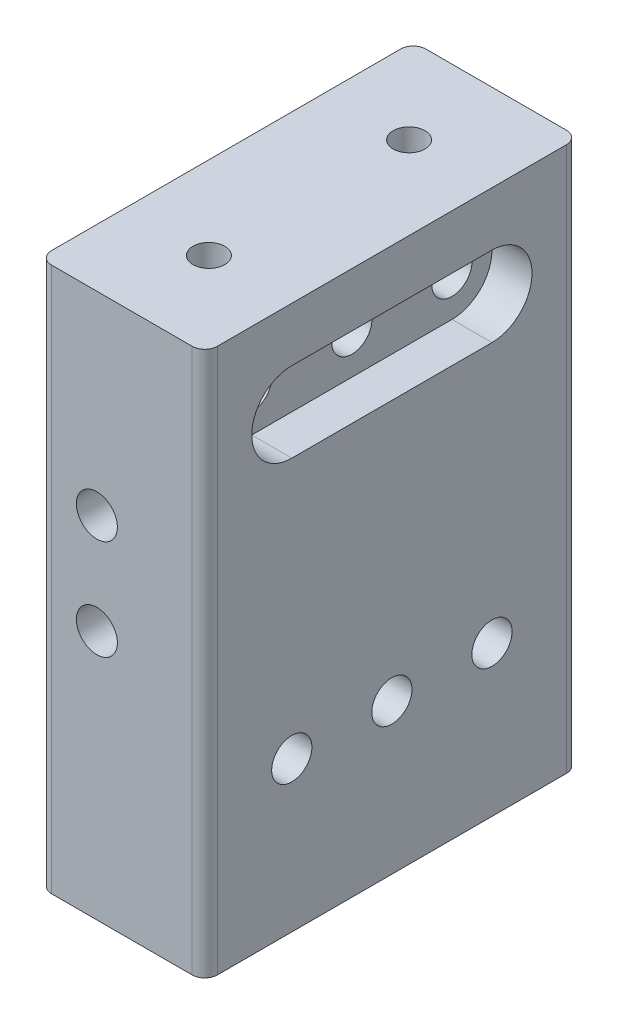
from build123d import *

# Parameters (mm, degrees)
SKETCH1_W           = 21.0312
SKETCH1_H           = 47.4853
BOSS_EXTRUDE1_DEPTH = 31.75
SKETCH2_R           = 2.6035
CUT_EXTRUDE1_DEPTH  = 59.081787674
SKETCH4_R           = 2.5527
CUT_EXTRUDE3_DEPTH  = 45.878584007
FILLET1_R           = 1.5875
CUT_EXTRUDE5_DEPTH  = 5.08
BOSS_EXTRUDE2_DEPTH = 5.588
SKETCH9_R           = 2.0193
CUT_EXTRUDE6_DEPTH  = 5.08
SKETCH10_R          = 2.5527
CUT_EXTRUDE7_DEPTH  = 49.991336443
CUT_EXTRUDE8_DEPTH  = 7.9375


with BuildPart() as part:
    # Sketch1 → Boss-Extrude1 (new, symmetric)
    with BuildSketch(Plane(origin=(0, 0, 0), x_dir=(1, 0, 0), z_dir=(0, 1, 0))):
        Rectangle(SKETCH1_W, SKETCH1_H)
    extrude(amount=BOSS_EXTRUDE1_DEPTH, both=True)

    # Sketch2 → Cut-Extrude1 (cut, through all)
    with BuildSketch(Plane.XY.offset(23.74265)):
        with Locations((-3.175, 0)):
            Circle(SKETCH2_R)
        with Locations((-3.175, 12.7)):
            Circle(SKETCH2_R)
    extrude(amount=-CUT_EXTRUDE1_DEPTH, mode=Mode.SUBTRACT)

    # Sketch4 → Cut-Extrude3 (cut, through all)
    with BuildSketch(Plane(origin=(10.5156, 0, 0), x_dir=(0, 0, -1), z_dir=(1, 0, 0))):
        with Locations((-12.7, 25.4)):
            Circle(SKETCH4_R)
        with Locations((12.7, 25.4)):
            Circle(SKETCH4_R)
        with Locations((0, 25.4)):
            Circle(SKETCH4_R)
    extrude(amount=-CUT_EXTRUDE3_DEPTH, mode=Mode.SUBTRACT)

    # Fillet1
    fillet1_edges = [part.edges().sort_by_distance(p)[0] for p in [
        (10.5156, 0, 23.74265),
        (-10.5156, 0, 23.74265),
        (-10.5156, 0, -23.74265),
        (10.5156, 0, -23.74265),
    ]]
    fillet(fillet1_edges, radius=FILLET1_R)

    # Sketch7 → Cut-Extrude5 (cut)
    with BuildSketch(Plane(origin=(10.5156, 0, 0), x_dir=(0, 0, -1), z_dir=(1, 0, 0))):
        with BuildLine():
            Line((-12.7, 30.48), (12.7, 30.48))
            ThreePointArc((12.7, 30.48), (17.78, 25.4), (12.7, 20.32))
            Line((12.7, 20.32), (-12.7, 20.32))
            ThreePointArc((-12.7, 20.32), (-17.78, 25.4), (-12.7, 30.48))
        make_face()
    extrude(amount=-CUT_EXTRUDE5_DEPTH, mode=Mode.SUBTRACT)

    # Sketch8 → Boss-Extrude2 (add)
    with BuildSketch(Plane(origin=(0, 31.75, 0), x_dir=(1, 0, 0), z_dir=(0, 1, 0))):
        with BuildLine():
            Line((-8.9281, -23.74265), (8.9281, -23.74265))
            ThreePointArc((8.9281, -23.74265), (10.050632015, -23.277682015), (10.5156, -22.15515))
            Line((10.5156, -22.15515), (10.5156, 22.15515))
            ThreePointArc((10.5156, 22.15515), (10.050632015, 23.277682015), (8.9281, 23.74265))
            Line((8.9281, 23.74265), (-8.9281, 23.74265))
            ThreePointArc((-8.9281, 23.74265), (-10.050632015, 23.277682015), (-10.5156, 22.15515))
            Line((-10.5156, 22.15515), (-10.5156, -22.15515))
            ThreePointArc((-10.5156, -22.15515), (-10.050632015, -23.277682015), (-8.9281, -23.74265))
        make_face()
    extrude(amount=BOSS_EXTRUDE2_DEPTH)

    # Sketch9 → Cut-Extrude6 (cut)
    with BuildSketch(Plane(origin=(0, 37.338, 0), x_dir=(1, 0, 0), z_dir=(0, 1, 0))):
        with Locations((0, 12.7)):
            Circle(SKETCH9_R)
        with Locations((0, -12.7)):
            Circle(SKETCH9_R)
    extrude(amount=-CUT_EXTRUDE6_DEPTH, mode=Mode.SUBTRACT)

    # Sketch10 → Cut-Extrude7 (cut, through all)
    with BuildSketch(Plane(origin=(10.5156, 0, 0), x_dir=(0, 0, -1), z_dir=(1, 0, 0))):
        with Locations((0, -12.7)):
            Circle(SKETCH10_R)
        with Locations((12.7, -12.7)):
            Circle(SKETCH10_R)
        with Locations((-12.7, -12.7)):
            Circle(SKETCH10_R)
    extrude(amount=-CUT_EXTRUDE7_DEPTH, mode=Mode.SUBTRACT)

    # Sketch11 → Cut-Extrude8 (cut)
    with BuildSketch(Plane.ZY.offset(10.5156)):
        with BuildLine():
            Line((-12.7, -3.24485), (12.7, -3.24485))
            ThreePointArc((12.7, -3.24485), (22.15515, -12.7), (12.7, -22.15515))
            Line((12.7, -22.15515), (-12.7, -22.15515))
            ThreePointArc((-12.7, -22.15515), (-22.15515, -12.7), (-12.7, -3.24485))
        make_face()
    extrude(amount=-CUT_EXTRUDE8_DEPTH, mode=Mode.SUBTRACT)


solid = part.part
